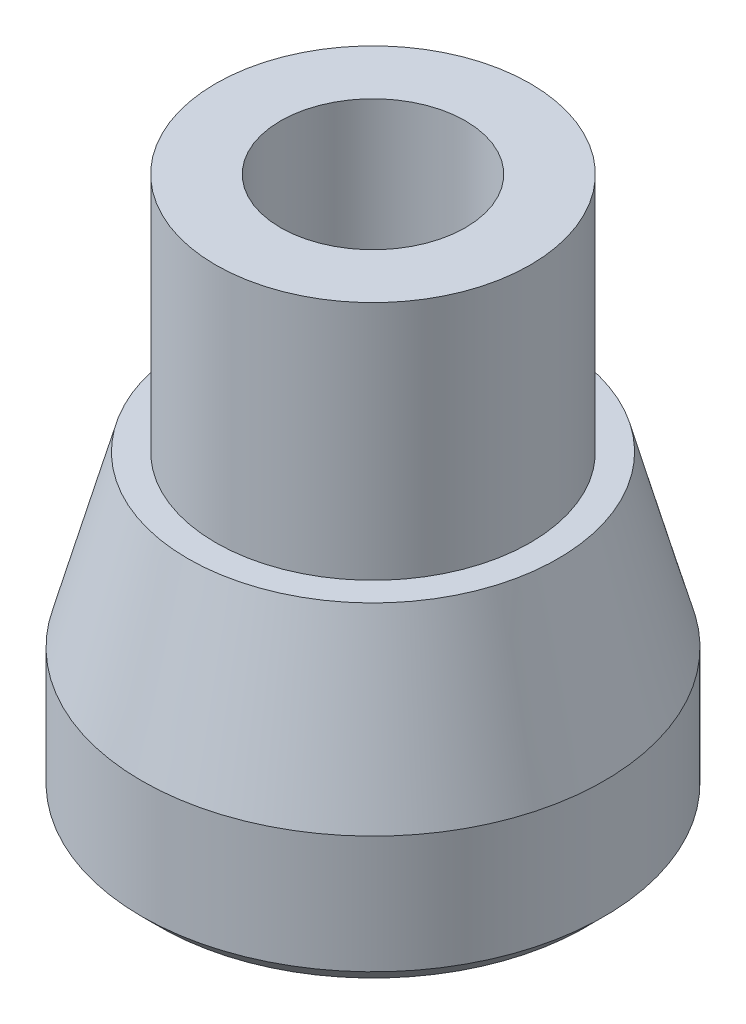
from build123d import *

# Parameters (mm, degrees)
BOSS_EXTRUDE1_START = 1
SKETCH2_R           = 12.5
SKETCH2_R_2         = 10.66166481
BOSS_EXTRUDE1_DEPTH = 1
CHAMFER1_SIZE       = 1


with BuildPart() as part:
    # Sketch1 → Revolve1 (revolve)
    with BuildSketch(Plane.XY):
        Polygon((5, 28.5), (8.5, 28.5), (8.5, 15.5), (10, 15.5), (12.5, 6.35), (12.5, 0), (10.66166481, 0), (5, 20.721693206), align=None)
    revolve(axis=Axis((0, 0, 0), (0, 1, 0)))

    # Sketch2 → Boss-Extrude1 (add)
    with BuildSketch(Plane.XZ.offset(BOSS_EXTRUDE1_START)):
        Circle(SKETCH2_R)
        Circle(SKETCH2_R_2, mode=Mode.SUBTRACT)
    extrude(amount=-BOSS_EXTRUDE1_DEPTH)

    # Chamfer1
    chamfer1_edges = [part.edges().sort_by_distance(p)[0] for p in [
        (-12.5, -1, 0),
    ]]
    chamfer(chamfer1_edges, length=CHAMFER1_SIZE)


solid = part.part
